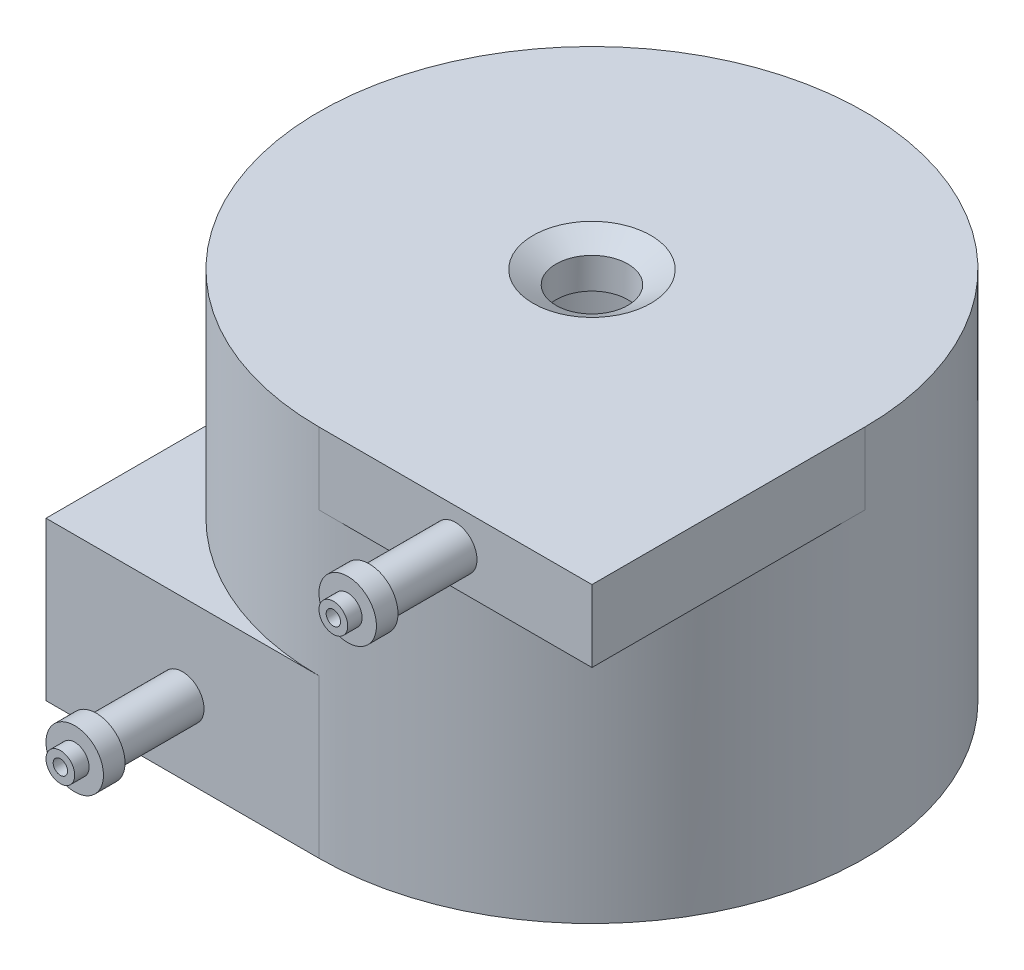
from build123d import *

# Parameters (mm, degrees)
SKETCH1_R            = 35
BOSS_EXTRUDE1_DEPTH  = 46
BOSS_EXTRUDE2_DEPTH  = 4
EXTRUDE_THIN1_DEPTH  = 16
SKETCH9_R            = 17
CUT_EXTRUDE1_DEPTH   = 44
SKETCH10_R           = 8
CUT_EXTRUDE2_DEPTH   = 10
CHAMFER1_SIZE        = 1
CHAMFER1_SIZE2       = 0.577350269
CHAMFER2_SIZE        = 1
CHAMFER2_SIZE2       = 0.577350269
FILLET1_R            = 1
SHELL2_START         = -49
SHELL2_OUTLINE_R     = 38
SHELL2_OUTLINE_R_2   = 14
SHELL2_DEPTH         = 52
SHELL2_2_DEPTH       = 22
SHELL2_START_2       = -5
SHELL2_3_OUTLINE_R   = 14
SHELL2_3_OUTLINE_R_2 = 5
SHELL2_3_DEPTH       = 8
SHELL2_START_3       = -7
SHELL2_4_DEPTH       = 2
SHELL2_START_4       = -45.0000001
SHELL2_5_OUTLINE_R   = 35
SHELL2_5_OUTLINE_R_2 = 17
SHELL2_5_DEPTH       = 45.0000001
SHELL2_START_5       = -46
SHELL2_6_DEPTH       = 16
SHELL2_START_6       = -4
SHELL2_7_DEPTH       = 4
SHELL2_START_7       = -1.422649831
SHELL2_8_OUTLINE_R   = 17
SHELL2_8_OUTLINE_R_2 = 8
SHELL2_8_DEPTH       = 0.845299462
SKETCH15_R           = 4
CUT_EXTRUDE5_DEPTH   = 2
SKETCH18_R           = 5
CUT_EXTRUDE6_DEPTH   = 1
CIRPATTERN4_COUNT    = 3
SKETCH24_R           = 3
SKETCH24_R_2         = 1
EXTRUDE_THIN2_DEPTH  = 15
CUT_EXTRUDE7_START   = -10
SKETCH24_2_R         = 1
CUT_EXTRUDE7_DEPTH   = 10
SKETCH27_R           = 4
SKETCH27_R_2         = 3
EXTRUDE_THIN3_DEPTH  = 3
SKETCH30_R           = 2
SKETCH30_R_2         = 1
EXTRUDE_THIN5_DEPTH  = 5
SKETCH28_R           = 4
SKETCH28_R_2         = 3
EXTRUDE_THIN6_DEPTH  = 3
SKETCH31_R           = 2
SKETCH31_R_2         = 1
EXTRUDE_THIN7_DEPTH  = 5


with BuildPart() as part:
    # Sketch1 → Boss-Extrude1 (new body)
    with BuildSketch(Plane(origin=(0, 0, 0), x_dir=(1, 0, 0), z_dir=(0, 1, 0))):
        with Locations(Location((0, 0, 0), (0, 0, 270))):
            Circle(SKETCH1_R)
    extrude(amount=-BOSS_EXTRUDE1_DEPTH)

    # Sketch1<3> → Boss-Extrude2 (add)
    with BuildSketch(Plane(origin=(0, 0, 0), x_dir=(1, 0, 0), z_dir=(0, 1, 0))):
        with BuildLine():
            Line((35, -35), (35, 0))
            ThreePointArc((35, 0), (24.748737342, -24.748737342), (0, -35))
            Line((0, -35), (35, -35))
        make_face()
    extrude(amount=-BOSS_EXTRUDE2_DEPTH)

    # Sketch5 → Extrude-Thin1 (add)
    with BuildSketch(Plane.XZ.offset(46)):
        Polygon((0, 35), (-35, 35), (-35, 0), (-25, 0), (-25, 25), (0, 25), align=None)
    extrude(amount=-EXTRUDE_THIN1_DEPTH)

    # Sketch9 → Cut-Extrude1 (cut)
    with BuildSketch(Plane.XZ.offset(46)):
        with Locations(Location((0, 0, 0), (0, 0, 270))):
            Circle(SKETCH9_R)
    extrude(amount=-CUT_EXTRUDE1_DEPTH, mode=Mode.SUBTRACT)

    # Sketch10 → Cut-Extrude2 (cut)
    with BuildSketch(Plane(origin=(0, 0, 0), x_dir=(1, 0, 0), z_dir=(0, 1, 0))):
        with Locations(Location((0, 0, 0), (0, 0, 270))):
            Circle(SKETCH10_R)
    extrude(amount=-CUT_EXTRUDE2_DEPTH, mode=Mode.SUBTRACT)

    # Chamfer1
    chamfer1_edges = [part.edges().sort_by_distance(p)[0] for p in [
        (0, 0, -8),
    ]]
    chamfer1_side = [part.faces().sort_by_distance(p)[0] for p in [
        (-24.048737342, 0, -24.048737342),
    ]]
    chamfer(chamfer1_edges, length=CHAMFER1_SIZE, length2=CHAMFER1_SIZE2, reference=chamfer1_side[0])

    # Chamfer2
    chamfer2_edges = [part.edges().sort_by_distance(p)[0] for p in [
        (0, -2, -8),
    ]]
    chamfer2_side = [part.faces().sort_by_distance(p)[0] for p in [
        (0, -2, 16.519167389),
    ]]
    chamfer(chamfer2_edges, length=CHAMFER2_SIZE, length2=CHAMFER2_SIZE2, reference=chamfer2_side[0])

    # Fillet1
    fillet1_edges = [part.edges().sort_by_distance(p)[0] for p in [
        (0, -46, 17),
    ]]
    fillet(fillet1_edges, radius=FILLET1_R)

    # Shell2: read off the stored shape, not the designer's step
    # Shell2 outline → Shell2 (add)
    with BuildSketch(Plane(origin=(0, 0, 0), x_dir=(1, 0, 0), z_dir=(0, 1, 0)).offset(SHELL2_START)):
        Circle(SHELL2_OUTLINE_R)
        Circle(SHELL2_OUTLINE_R_2, mode=Mode.SUBTRACT)
    extrude(amount=SHELL2_DEPTH)

    # Shell2 2 outline → Shell2 2 (add)
    with BuildSketch(Plane(origin=(0, 0, 0), x_dir=(1, 0, 0), z_dir=(0, 1, 0)).offset(SHELL2_START)):
        with BuildLine():
            ThreePointArc((0, -38), (-26.870057685, -26.870057685), (-38, 0))
            Line((-38, 0), (-38, -38))
            Line((-38, -38), (0, -38))
        make_face()
    extrude(amount=SHELL2_2_DEPTH)

    # Shell2 3 outline → Shell2 3 (add)
    # profile 1 of 2: a face of its own
    with BuildSketch(Plane(origin=(0, 0, 0), x_dir=(1, 0, 0), z_dir=(0, 1, 0)).offset(SHELL2_START_2)):
        with BuildLine():
            Line((38, -38), (38, 0))
            ThreePointArc((38, 0), (26.870057685, -26.870057685), (0, -38))
            Line((0, -38), (38, -38))
        make_face()
    # profile 2 of 2: a face of its own
    with BuildSketch(Plane(origin=(0, 0, 0), x_dir=(1, 0, 0), z_dir=(0, 1, 0)).offset(SHELL2_START_2)):
        Circle(SHELL2_3_OUTLINE_R)
        Circle(SHELL2_3_OUTLINE_R_2, mode=Mode.SUBTRACT)
    extrude(amount=SHELL2_3_DEPTH)

    # Shell2 4 outline → Shell2 4 (add)
    with BuildSketch(Plane(origin=(0, 0, 0), x_dir=(1, 0, 0), z_dir=(0, 1, 0)).offset(SHELL2_START_3)):
        with BuildLine():
            Line((38, -38), (38, 0))
            ThreePointArc((38, 0), (26.870057685, -26.870057685), (0, -38))
            Line((0, -38), (38, -38))
        make_face()
    extrude(amount=SHELL2_4_DEPTH)

    # Shell2 5 outline → Shell2 5 (cut)
    with BuildSketch(Plane(origin=(0, 0, 0), x_dir=(1, 0, 0), z_dir=(0, 1, 0)).offset(SHELL2_START_4)):
        Circle(SHELL2_5_OUTLINE_R)
        Circle(SHELL2_5_OUTLINE_R_2, mode=Mode.SUBTRACT)
    extrude(amount=SHELL2_5_DEPTH, mode=Mode.SUBTRACT)

    # Shell2 6 outline → Shell2 6 (cut)
    with BuildSketch(Plane(origin=(0, 0, 0), x_dir=(1, 0, 0), z_dir=(0, 1, 0)).offset(SHELL2_START_5)):
        with BuildLine():
            ThreePointArc((-25, -24.494897428), (-32.403703492, -13.228756555), (-35, 0))
            Line((-35, 0), (-35, -35))
            Line((-35, -35), (0, -35))
            ThreePointArc((0, -35), (-13.228756555, -32.403703492), (-24.494897428, -25))
            Line((-24.494897428, -25), (-25, -25))
            Line((-25, -25), (-25, -24.494897428))
        make_face()
    extrude(amount=SHELL2_6_DEPTH, mode=Mode.SUBTRACT)

    # Shell2 7 outline → Shell2 7 (cut)
    with BuildSketch(Plane(origin=(0, 0, 0), x_dir=(1, 0, 0), z_dir=(0, 1, 0)).offset(SHELL2_START_6)):
        with BuildLine():
            Line((35, -35), (35, 0))
            ThreePointArc((35, 0), (24.748737342, -24.748737342), (0, -35))
            Line((0, -35), (35, -35))
        make_face()
    extrude(amount=SHELL2_7_DEPTH, mode=Mode.SUBTRACT)

    # Shell2 8 outline → Shell2 8 (cut)
    with BuildSketch(Plane(origin=(0, 0, 0), x_dir=(1, 0, 0), z_dir=(0, 1, 0)).offset(SHELL2_START_7)):
        Circle(SHELL2_8_OUTLINE_R)
        Circle(SHELL2_8_OUTLINE_R_2, mode=Mode.SUBTRACT)
    extrude(amount=SHELL2_8_DEPTH, mode=Mode.SUBTRACT)

    # Shell2 9 outline → Shell2 9 (revolve, cut)
    with BuildSketch(Plane.XY):
        Polygon((5, 3), (5, 1.154700538), (8.196152423, 3), align=None)
        Polygon((17, -0.577350369), (17, 0), (9, 0), (8, -0.577350319), align=None)
        Polygon((8, -1.422649781), (9, -2), (17, -2), (17, -1.422649831), align=None)
        Polygon((8.196152423, -5), (5, -3.154700538), (5, -5), align=None)
        with BuildLine():
            Line((14, -45), (14, -49))
            Line((14, -49), (18, -49))
            ThreePointArc((18, -49), (15.171572875, -47.828427125), (14, -45))
        make_face()
        with BuildLine():
            ThreePointArc((17, -45), (17.292893219, -45.707106781), (18, -46))
            Line((18, -46), (35, -46))
            Line((35, -46), (35, -45.0000001))
            Line((35, -45.0000001), (17, -45))
        make_face()
    revolve(axis=Axis((0, 0, 0), (0, 1, 0)), mode=Mode.SUBTRACT)

    # Sketch15 → Cut-Extrude5 (cut)
    with BuildSketch(Plane.XZ.offset(49)):
        with Locations(Location((0, 24, 0), (0, 0, 270))):
            Circle(SKETCH15_R)
    cut_extrude5 = extrude(amount=-CUT_EXTRUDE5_DEPTH, mode=Mode.SUBTRACT)

    # Sketch18 → Cut-Extrude6 (cut)
    with BuildSketch(Plane.XZ.offset(49)):
        with Locations(Location((0, 24, 0), (0, 0, 270))):
            Circle(SKETCH18_R)
    cut_extrude6 = extrude(amount=-CUT_EXTRUDE6_DEPTH, mode=Mode.SUBTRACT)

    # CirPattern4: Cut-Extrude5, Cut-Extrude6 ×3 about axis
    cirpattern4_axis = Axis((0, 0, 0), (0, 1, 0))
    add([cut_extrude5.rotate(cirpattern4_axis, i * 360 / CIRPATTERN4_COUNT) for i in range(1, CIRPATTERN4_COUNT)], mode=Mode.SUBTRACT)
    add([cut_extrude6.rotate(cirpattern4_axis, i * 360 / CIRPATTERN4_COUNT) for i in range(1, CIRPATTERN4_COUNT)], mode=Mode.SUBTRACT)

    # Sketch24 → Extrude-Thin2 (add)
    # profile 1 of 2: a face of its own
    with BuildSketch(Plane.XY.offset(38)):
        with Locations((-19, -39)):
            Circle(SKETCH24_R)
        with Locations((-19, -39)):
            Circle(SKETCH24_R_2, mode=Mode.SUBTRACT)
    # profile 2 of 2: a face of its own
    with BuildSketch(Plane.XY.offset(38)):
        with Locations((19, -2)):
            Circle(SKETCH24_R)
        with Locations((19, -2)):
            Circle(SKETCH24_R_2, mode=Mode.SUBTRACT)
    extrude(amount=EXTRUDE_THIN2_DEPTH)

    # Sketch24<2> → Cut-Extrude7 (cut)
    with BuildSketch(Plane.XY.offset(38).offset(CUT_EXTRUDE7_START)):
        with Locations((-19, -39)):
            Circle(SKETCH24_2_R)
        with Locations(Location((19, -2, 0), (0, 0, 180))):
            Circle(SKETCH24_2_R)
    extrude(amount=CUT_EXTRUDE7_DEPTH, mode=Mode.SUBTRACT)

    # Sketch27 → Extrude-Thin3 (add)
    with BuildSketch(Plane.XY.offset(50)):
        with Locations((19, -2)):
            Circle(SKETCH27_R)
        with Locations((19, -2)):
            Circle(SKETCH27_R_2, mode=Mode.SUBTRACT)
    extrude(amount=EXTRUDE_THIN3_DEPTH)

    # Sketch30 → Extrude-Thin5 (add)
    with BuildSketch(Plane.XY.offset(50)):
        with Locations((19, -2)):
            Circle(SKETCH30_R)
        with Locations((19, -2)):
            Circle(SKETCH30_R_2, mode=Mode.SUBTRACT)
    extrude(amount=EXTRUDE_THIN5_DEPTH)

    # Sketch28 → Extrude-Thin6 (add)
    with BuildSketch(Plane.XY.offset(50)):
        with Locations((-19, -39)):
            Circle(SKETCH28_R)
        with Locations((-19, -39)):
            Circle(SKETCH28_R_2, mode=Mode.SUBTRACT)
    extrude(amount=EXTRUDE_THIN6_DEPTH)

    # Sketch31 → Extrude-Thin7 (add)
    with BuildSketch(Plane.XY.offset(50)):
        with Locations((-19, -39)):
            Circle(SKETCH31_R)
        with Locations((-19, -39)):
            Circle(SKETCH31_R_2, mode=Mode.SUBTRACT)
    extrude(amount=EXTRUDE_THIN7_DEPTH)


solid = part.part
